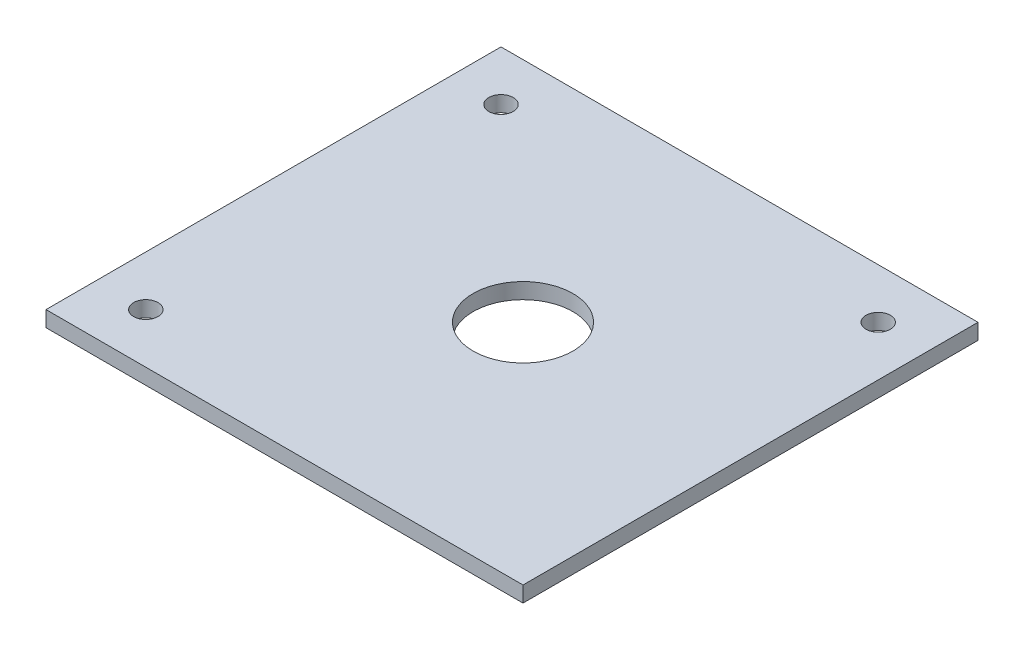
from build123d import *

# Parameters (mm, degrees)
SKETCH1_W           = 121.4
SKETCH1_H           = 115.8
SKETCH1_R           = 12.7
SKETCH1_R_2         = 3.1
BOSS_EXTRUDE1_DEPTH = 4


with BuildPart() as part:
    # Sketch1 → Boss-Extrude1 (new body)
    with BuildSketch(Plane(origin=(0, 0, 0), x_dir=(1, 0, 0), z_dir=(0, 1, 0))):
        with Locations((61.417527055, -57.9)):
            Rectangle(SKETCH1_W, SKETCH1_H)
        with Locations((64.217527055, -57.9)):
            Circle(SKETCH1_R, mode=Mode.SUBTRACT)
        with Locations((13.417527055, -12.7)):
            Circle(SKETCH1_R_2, mode=Mode.SUBTRACT)
        with Locations((109.417527055, -12.7)):
            Circle(SKETCH1_R_2, mode=Mode.SUBTRACT)
        with Locations((13.417527055, -103.1)):
            Circle(SKETCH1_R_2, mode=Mode.SUBTRACT)
    extrude(amount=BOSS_EXTRUDE1_DEPTH)


solid = part.part
